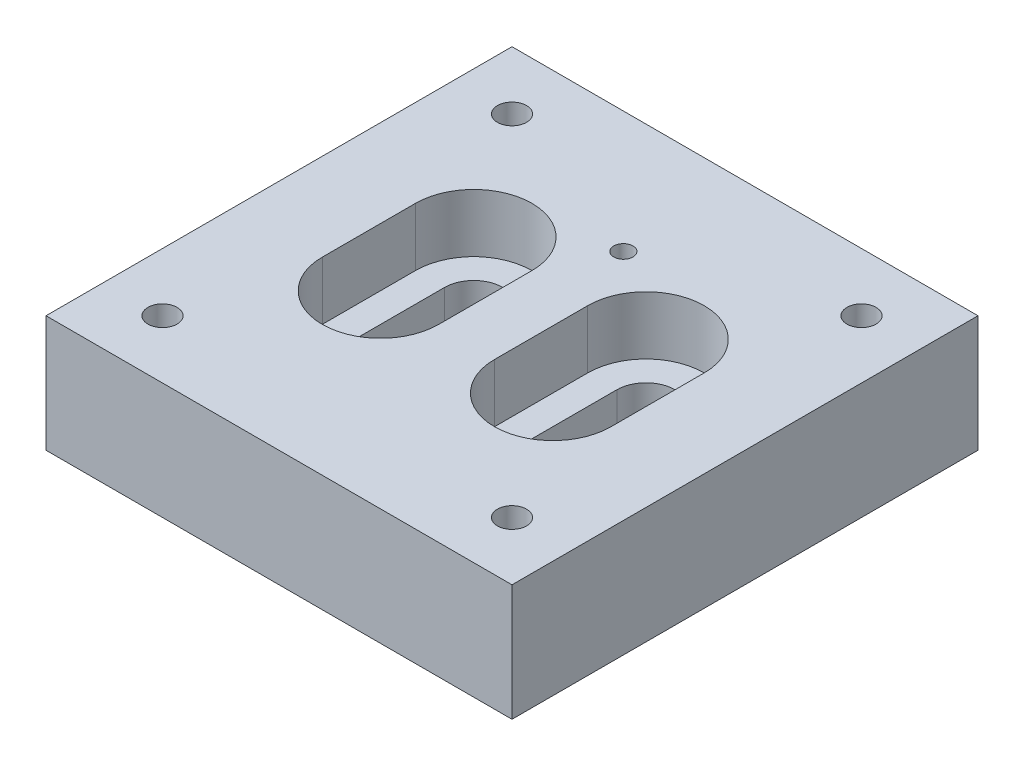
from build123d import *

# Parameters (mm, degrees)
IZIM1_W                     = 80
IZIM1_H                     = 80
IZIM1_R                     = 2.5
Y_KSEKLIK_EKSTR_ZYON1_DEPTH = 20
KES_EKSTR_ZYON2_DEPTH       = 61
KES_EKSTR_ZYON3_START       = 10
KES_EKSTR_ZYON3_DEPTH       = 10
M4X0_7_DI_LI_DELIK1_D       = 3.3


# Read off the part's stored shape, not the designer's step: Kes-Ekstrüzyon3
with BuildPart() as part:
    # Çizim1 → Yükseklik-Ekstrüzyon1 (new body)
    with BuildSketch(Plane(origin=(0, 0, 0), x_dir=(1, 0, 0), z_dir=(0, 1, 0))):
        Rectangle(IZIM1_W, IZIM1_H)
        with Locations(Location((-30, 30, 0), (0, 0, 270))):
            Circle(IZIM1_R, mode=Mode.SUBTRACT)
        with Locations(Location((30, 30, 0), (0, 0, 270))):
            Circle(IZIM1_R, mode=Mode.SUBTRACT)
        with Locations(Location((-30, -30, 0), (0, 0, 270))):
            Circle(IZIM1_R, mode=Mode.SUBTRACT)
        with Locations(Location((30, -30, 0), (0, 0, 270))):
            Circle(IZIM1_R, mode=Mode.SUBTRACT)
    extrude(amount=Y_KSEKLIK_EKSTR_ZYON1_DEPTH)

    # Çizim2 → Kes-Ekstrüzyon2 (cut, through all)
    with BuildSketch(Plane(origin=(0, 20, 0), x_dir=(1, 0, 0), z_dir=(0, 1, 0))):
        with BuildLine():
            Line((-10, 8.426169555), (-10, -7.573830445))
            ThreePointArc((-10, -7.573830445), (-15, -12.573830445), (-20, -7.573830445))
            Line((-20, -7.573830445), (-20, 8.426169555))
            ThreePointArc((-20, 8.426169555), (-15, 13.426169555), (-10, 8.426169555))
        make_face()
        with BuildLine():
            Line((20, 8), (20, -8))
            ThreePointArc((20, -8), (15, -13), (10, -8))
            Line((10, -8), (10, 8))
            ThreePointArc((10, 8), (15, 13), (20, 8))
        make_face()
    extrude(amount=-KES_EKSTR_ZYON2_DEPTH, mode=Mode.SUBTRACT)

    # Kes-Ekstrüzyon3 outline → Kes-Ekstrüzyon3 (cut)
    # profile 1 of 2: a face of its own
    with BuildSketch(Plane(origin=(0, 0, 0), x_dir=(1, 0, 0), z_dir=(0, 1, 0)).offset(KES_EKSTR_ZYON3_START)):
        with BuildLine():
            Line((-25, 8.426169555), (-25, -7.573830445))
            ThreePointArc((-25, -7.573830445), (-15, -17.573830445), (-5, -7.573830445))
            Line((-5, -7.573830445), (-5, 8.426169555))
            ThreePointArc((-5, 8.426169555), (-15, 18.426169555), (-25, 8.426169555))
        make_face()
        with BuildLine():
            ThreePointArc((-20, 8.426169555), (-15, 13.426169555), (-10, 8.426169555))
            Line((-10, 8.426169555), (-10, -7.573830445))
            ThreePointArc((-10, -7.573830445), (-15, -12.573830445), (-20, -7.573830445))
            Line((-20, -7.573830445), (-20, 8.426169555))
        make_face(mode=Mode.SUBTRACT)
    # profile 2 of 2: a face of its own
    with BuildSketch(Plane(origin=(0, 0, 0), x_dir=(1, 0, 0), z_dir=(0, 1, 0)).offset(KES_EKSTR_ZYON3_START)):
        with BuildLine():
            Line((25, -8), (25, 8))
            ThreePointArc((25, 8), (15, 18), (5, 8))
            Line((5, 8), (5, -8))
            ThreePointArc((5, -8), (15, -18), (25, -8))
        make_face()
        with BuildLine():
            ThreePointArc((10, 8), (15, 13), (20, 8))
            Line((20, 8), (20, -8))
            ThreePointArc((20, -8), (15, -13), (10, -8))
            Line((10, -8), (10, 8))
        make_face(mode=Mode.SUBTRACT)
    extrude(amount=KES_EKSTR_ZYON3_DEPTH, mode=Mode.SUBTRACT)

    # M4x0.7 Dişli Delik1 (through all)
    with Locations(Plane(origin=(0, 20, 0), x_dir=(1, 0, 0), z_dir=(0, 1, 0))):
        with Locations((0, 19.118083018)):
            Hole(M4X0_7_DI_LI_DELIK1_D / 2)


solid = part.part
